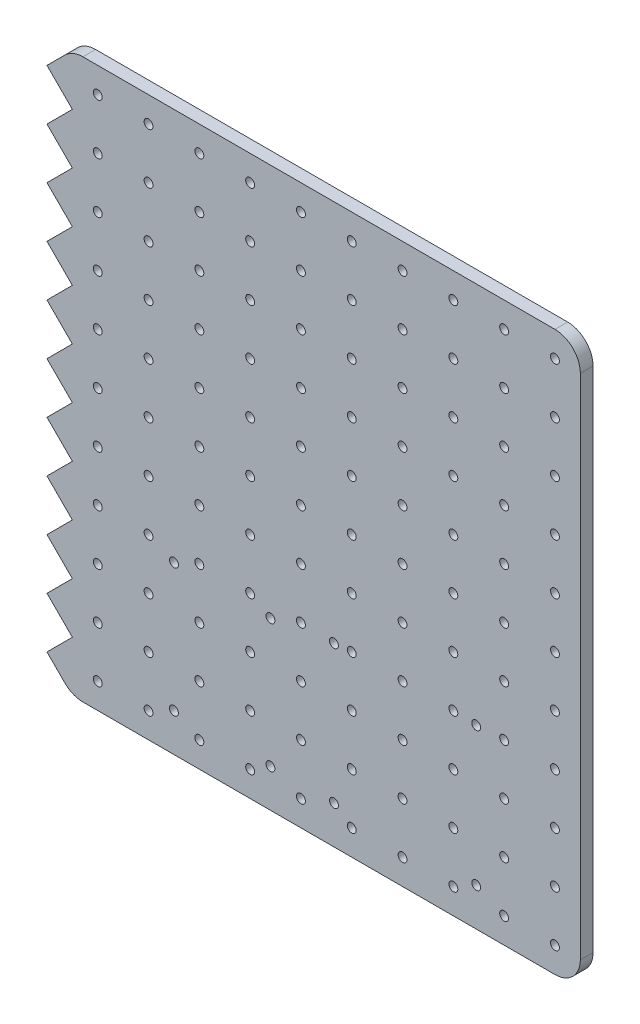
from build123d import *

# Parameters (mm, degrees)
SKETCH1_R           = 1.75
BOSS_EXTRUDE1_DEPTH = 5
FILLET1_R           = 10


with BuildPart() as part:
    # Sketch1 → Boss-Extrude1 (new body)
    with BuildSketch(Plane.XY):
        Polygon((0, 0), (-10, 10), (0, 20), (-10, 30), (0, 40), (-10, 50), (0, 60), (-10, 70), (0, 80), (-10, 90), (0, 100), (-10, 110), (0, 120), (-10, 130), (0, 140), (-10, 150), (0, 160), (-10, 170), (0, 180), (-10, 190), (0, 200), (-10, 210), (0, 220), (200, 220), (200, 0), align=None)
        with Locations((190, 210)):
            Circle(SKETCH1_R, mode=Mode.SUBTRACT)
        with Locations((190, 190)):
            Circle(SKETCH1_R, mode=Mode.SUBTRACT)
        with Locations((190, 170)):
            Circle(SKETCH1_R, mode=Mode.SUBTRACT)
        with Locations((190, 150)):
            Circle(SKETCH1_R, mode=Mode.SUBTRACT)
        with Locations((190, 130)):
            Circle(SKETCH1_R, mode=Mode.SUBTRACT)
        with Locations((190, 110)):
            Circle(SKETCH1_R, mode=Mode.SUBTRACT)
        with Locations((190, 90)):
            Circle(SKETCH1_R, mode=Mode.SUBTRACT)
        with Locations((190, 70)):
            Circle(SKETCH1_R, mode=Mode.SUBTRACT)
        with Locations((190, 50)):
            Circle(SKETCH1_R, mode=Mode.SUBTRACT)
        with Locations((190, 30)):
            Circle(SKETCH1_R, mode=Mode.SUBTRACT)
        with Locations((190, 10)):
            Circle(SKETCH1_R, mode=Mode.SUBTRACT)
        with Locations((170, 210)):
            Circle(SKETCH1_R, mode=Mode.SUBTRACT)
        with Locations((170, 190)):
            Circle(SKETCH1_R, mode=Mode.SUBTRACT)
        with Locations((170, 170)):
            Circle(SKETCH1_R, mode=Mode.SUBTRACT)
        with Locations((170, 150)):
            Circle(SKETCH1_R, mode=Mode.SUBTRACT)
        with Locations((170, 130)):
            Circle(SKETCH1_R, mode=Mode.SUBTRACT)
        with Locations((150, 130)):
            Circle(SKETCH1_R, mode=Mode.SUBTRACT)
        with Locations((150, 150)):
            Circle(SKETCH1_R, mode=Mode.SUBTRACT)
        with Locations((150, 170)):
            Circle(SKETCH1_R, mode=Mode.SUBTRACT)
        with Locations((150, 190)):
            Circle(SKETCH1_R, mode=Mode.SUBTRACT)
        with Locations((150, 210)):
            Circle(SKETCH1_R, mode=Mode.SUBTRACT)
        with Locations((130, 210)):
            Circle(SKETCH1_R, mode=Mode.SUBTRACT)
        with Locations((130, 190)):
            Circle(SKETCH1_R, mode=Mode.SUBTRACT)
        with Locations((130, 170)):
            Circle(SKETCH1_R, mode=Mode.SUBTRACT)
        with Locations((130, 150)):
            Circle(SKETCH1_R, mode=Mode.SUBTRACT)
        with Locations((130, 130)):
            Circle(SKETCH1_R, mode=Mode.SUBTRACT)
        with Locations((110, 130)):
            Circle(SKETCH1_R, mode=Mode.SUBTRACT)
        with Locations((110, 150)):
            Circle(SKETCH1_R, mode=Mode.SUBTRACT)
        with Locations((110, 170)):
            Circle(SKETCH1_R, mode=Mode.SUBTRACT)
        with Locations((110, 190)):
            Circle(SKETCH1_R, mode=Mode.SUBTRACT)
        with Locations((110, 210)):
            Circle(SKETCH1_R, mode=Mode.SUBTRACT)
        with Locations((90, 210)):
            Circle(SKETCH1_R, mode=Mode.SUBTRACT)
        with Locations((90, 190)):
            Circle(SKETCH1_R, mode=Mode.SUBTRACT)
        with Locations((90, 170)):
            Circle(SKETCH1_R, mode=Mode.SUBTRACT)
        with Locations((90, 150)):
            Circle(SKETCH1_R, mode=Mode.SUBTRACT)
        with Locations((90, 130)):
            Circle(SKETCH1_R, mode=Mode.SUBTRACT)
        with Locations((70, 130)):
            Circle(SKETCH1_R, mode=Mode.SUBTRACT)
        with Locations((70, 150)):
            Circle(SKETCH1_R, mode=Mode.SUBTRACT)
        with Locations((70, 170)):
            Circle(SKETCH1_R, mode=Mode.SUBTRACT)
        with Locations((70, 190)):
            Circle(SKETCH1_R, mode=Mode.SUBTRACT)
        with Locations((70, 210)):
            Circle(SKETCH1_R, mode=Mode.SUBTRACT)
        with Locations((50, 210)):
            Circle(SKETCH1_R, mode=Mode.SUBTRACT)
        with Locations((50, 190)):
            Circle(SKETCH1_R, mode=Mode.SUBTRACT)
        with Locations((50, 170)):
            Circle(SKETCH1_R, mode=Mode.SUBTRACT)
        with Locations((50, 150)):
            Circle(SKETCH1_R, mode=Mode.SUBTRACT)
        with Locations((50, 130)):
            Circle(SKETCH1_R, mode=Mode.SUBTRACT)
        with Locations((30, 130)):
            Circle(SKETCH1_R, mode=Mode.SUBTRACT)
        with Locations((30, 150)):
            Circle(SKETCH1_R, mode=Mode.SUBTRACT)
        with Locations((30, 170)):
            Circle(SKETCH1_R, mode=Mode.SUBTRACT)
        with Locations((30, 190)):
            Circle(SKETCH1_R, mode=Mode.SUBTRACT)
        with Locations((30, 210)):
            Circle(SKETCH1_R, mode=Mode.SUBTRACT)
        with Locations((10, 210)):
            Circle(SKETCH1_R, mode=Mode.SUBTRACT)
        with Locations((10, 190)):
            Circle(SKETCH1_R, mode=Mode.SUBTRACT)
        with Locations((10, 170)):
            Circle(SKETCH1_R, mode=Mode.SUBTRACT)
        with Locations((10, 150)):
            Circle(SKETCH1_R, mode=Mode.SUBTRACT)
        with Locations((10, 130)):
            Circle(SKETCH1_R, mode=Mode.SUBTRACT)
        with Locations((10, 10)):
            Circle(SKETCH1_R, mode=Mode.SUBTRACT)
        with Locations((10, 30)):
            Circle(SKETCH1_R, mode=Mode.SUBTRACT)
        with Locations((10, 50)):
            Circle(SKETCH1_R, mode=Mode.SUBTRACT)
        with Locations((10, 70)):
            Circle(SKETCH1_R, mode=Mode.SUBTRACT)
        with Locations((10, 90)):
            Circle(SKETCH1_R, mode=Mode.SUBTRACT)
        with Locations((10, 110)):
            Circle(SKETCH1_R, mode=Mode.SUBTRACT)
        with Locations((30, 110)):
            Circle(SKETCH1_R, mode=Mode.SUBTRACT)
        with Locations((30, 90)):
            Circle(SKETCH1_R, mode=Mode.SUBTRACT)
        with Locations((30, 70)):
            Circle(SKETCH1_R, mode=Mode.SUBTRACT)
        with Locations((30, 50)):
            Circle(SKETCH1_R, mode=Mode.SUBTRACT)
        with Locations((30, 30)):
            Circle(SKETCH1_R, mode=Mode.SUBTRACT)
        with Locations((30, 10)):
            Circle(SKETCH1_R, mode=Mode.SUBTRACT)
        with Locations((50, 10)):
            Circle(SKETCH1_R, mode=Mode.SUBTRACT)
        with Locations((70, 10)):
            Circle(SKETCH1_R, mode=Mode.SUBTRACT)
        with Locations((70, 30)):
            Circle(SKETCH1_R, mode=Mode.SUBTRACT)
        with Locations((50, 30)):
            Circle(SKETCH1_R, mode=Mode.SUBTRACT)
        with Locations((50, 50)):
            Circle(SKETCH1_R, mode=Mode.SUBTRACT)
        with Locations((50, 70)):
            Circle(SKETCH1_R, mode=Mode.SUBTRACT)
        with Locations((50, 90)):
            Circle(SKETCH1_R, mode=Mode.SUBTRACT)
        with Locations((50, 110)):
            Circle(SKETCH1_R, mode=Mode.SUBTRACT)
        with Locations((70, 110)):
            Circle(SKETCH1_R, mode=Mode.SUBTRACT)
        with Locations((70, 90)):
            Circle(SKETCH1_R, mode=Mode.SUBTRACT)
        with Locations((70, 70)):
            Circle(SKETCH1_R, mode=Mode.SUBTRACT)
        with Locations((70, 50)):
            Circle(SKETCH1_R, mode=Mode.SUBTRACT)
        with Locations((90, 10)):
            Circle(SKETCH1_R, mode=Mode.SUBTRACT)
        with Locations((90, 30)):
            Circle(SKETCH1_R, mode=Mode.SUBTRACT)
        with Locations((90, 50)):
            Circle(SKETCH1_R, mode=Mode.SUBTRACT)
        with Locations((90, 70)):
            Circle(SKETCH1_R, mode=Mode.SUBTRACT)
        with Locations((90, 90)):
            Circle(SKETCH1_R, mode=Mode.SUBTRACT)
        with Locations((110, 90)):
            Circle(SKETCH1_R, mode=Mode.SUBTRACT)
        with Locations((90, 110)):
            Circle(SKETCH1_R, mode=Mode.SUBTRACT)
        with Locations((110, 110)):
            Circle(SKETCH1_R, mode=Mode.SUBTRACT)
        with Locations((130, 110)):
            Circle(SKETCH1_R, mode=Mode.SUBTRACT)
        with Locations((150, 110)):
            Circle(SKETCH1_R, mode=Mode.SUBTRACT)
        with Locations((170, 110)):
            Circle(SKETCH1_R, mode=Mode.SUBTRACT)
        with Locations((170, 90)):
            Circle(SKETCH1_R, mode=Mode.SUBTRACT)
        with Locations((150, 90)):
            Circle(SKETCH1_R, mode=Mode.SUBTRACT)
        with Locations((130, 90)):
            Circle(SKETCH1_R, mode=Mode.SUBTRACT)
        with Locations((110, 70)):
            Circle(SKETCH1_R, mode=Mode.SUBTRACT)
        with Locations((130, 70)):
            Circle(SKETCH1_R, mode=Mode.SUBTRACT)
        with Locations((150, 70)):
            Circle(SKETCH1_R, mode=Mode.SUBTRACT)
        with Locations((170, 70)):
            Circle(SKETCH1_R, mode=Mode.SUBTRACT)
        with Locations((170, 50)):
            Circle(SKETCH1_R, mode=Mode.SUBTRACT)
        with Locations((150, 50)):
            Circle(SKETCH1_R, mode=Mode.SUBTRACT)
        with Locations((130, 50)):
            Circle(SKETCH1_R, mode=Mode.SUBTRACT)
        with Locations((110, 50)):
            Circle(SKETCH1_R, mode=Mode.SUBTRACT)
        with Locations((110, 30)):
            Circle(SKETCH1_R, mode=Mode.SUBTRACT)
        with Locations((110, 10)):
            Circle(SKETCH1_R, mode=Mode.SUBTRACT)
        with Locations((130, 10)):
            Circle(SKETCH1_R, mode=Mode.SUBTRACT)
        with Locations((130, 30)):
            Circle(SKETCH1_R, mode=Mode.SUBTRACT)
        with Locations((150, 10)):
            Circle(SKETCH1_R, mode=Mode.SUBTRACT)
        with Locations((150, 30)):
            Circle(SKETCH1_R, mode=Mode.SUBTRACT)
        with Locations((170, 10)):
            Circle(SKETCH1_R, mode=Mode.SUBTRACT)
        with Locations((170, 30)):
            Circle(SKETCH1_R, mode=Mode.SUBTRACT)
        with Locations((40, 65.5)):
            Circle(SKETCH1_R, mode=Mode.SUBTRACT)
        with Locations((40, 15)):
            Circle(SKETCH1_R, mode=Mode.SUBTRACT)
        with Locations((78, 15)):
            Circle(SKETCH1_R, mode=Mode.SUBTRACT)
        with Locations((78, 65.5)):
            Circle(SKETCH1_R, mode=Mode.SUBTRACT)
        with Locations((103, 69.5)):
            Circle(SKETCH1_R, mode=Mode.SUBTRACT)
        with Locations((103, 15)):
            Circle(SKETCH1_R, mode=Mode.SUBTRACT)
        with Locations((159, 15)):
            Circle(SKETCH1_R, mode=Mode.SUBTRACT)
        with Locations((159, 69.5)):
            Circle(SKETCH1_R, mode=Mode.SUBTRACT)
    extrude(amount=BOSS_EXTRUDE1_DEPTH)

    # Fillet1
    fillet1_edges = [part.edges().sort_by_distance(p)[0] for p in [
        (0, 0, 2.5),
        (200, 0, 2.5),
        (0, 220, 2.5),
        (200, 220, 2.5),
    ]]
    fillet(fillet1_edges, radius=FILLET1_R)


solid = part.part
